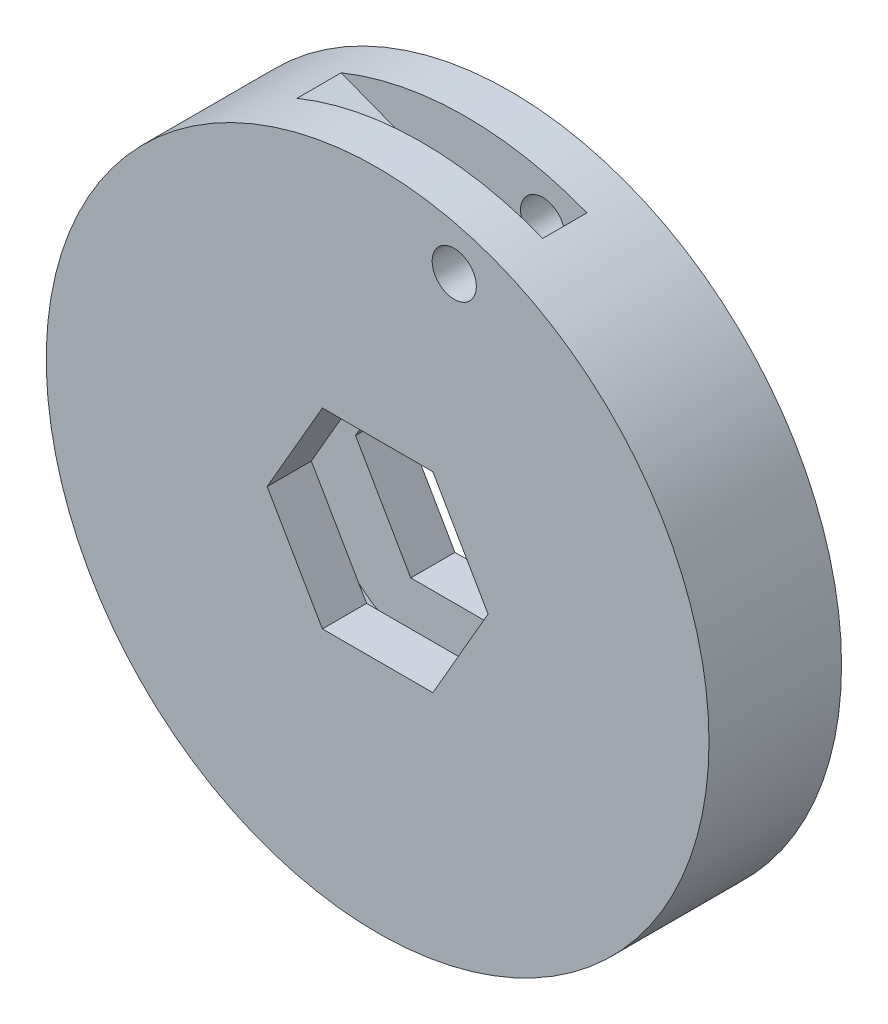
from build123d import *
from build123d.topology import SkipClean

# Parameters (mm, degrees)
SKETCH_1_R               = 15
EXTRUDE_1_DEPTH          = 6
CUT_EXTRUDE_1_DEPTH      = 23.045407685
SKETCH_5_R               = 7.5
CUT_EXTRUDE_2_DEPTH      = 23.045407685
EXTRUDE_START            = -2
SKETCH_6_R               = 15
EXTRUDE_4_DEPTH          = 2
SKETCH_7_R               = 15
EXTRUDE_5_DEPTH          = 2
CUT_EXTRUDE_3_DEPTH      = 22.587033145
CUT_EXTRUDE_3_DEPTH_BACK = 22.587033145
SKETCH_8_R               = 1
CUT_EXTRUDE_4_DEPTH      = 23.045407685


with BuildPart() as part:
    # 草图1 → 凸台-拉伸1 (new body)
    with BuildSketch(Plane.XY):
        Circle(SKETCH_1_R)
    extrude(amount=EXTRUDE_1_DEPTH)

    # 草图2 → 切除-拉伸1 (cut, through all)
    with BuildSketch(Plane.XY.offset(6)):
        with BuildLine():
            Line((-5.64957048, 13.895407637), (2.749675697, 10.662349694))
            ThreePointArc((2.749675697, 10.662349694), (4.597345514, 10.878128051), (5.468121165, 12.521963144))
            Line((5.468121165, 12.521963144), (5.473092316, 13.965860536))
            ThreePointArc((5.473092316, 13.965860536), (-0.095010727, 14.999699096), (-5.64957048, 13.895407637))
        make_face()
    extrude(amount=-CUT_EXTRUDE_1_DEPTH, mode=Mode.SUBTRACT)

    # 草图5 → 切除-拉伸2 (cut, through all)
    with BuildSketch(Plane.XY.offset(6)):
        Circle(SKETCH_5_R)
    extrude(amount=-CUT_EXTRUDE_2_DEPTH, mode=Mode.SUBTRACT)

    # 草图6 → 凸台-拉伸4 (add)
    with BuildSketch(Plane.XY.offset(6).offset(EXTRUDE_START)):
        Circle(SKETCH_6_R)
    extrude(amount=EXTRUDE_4_DEPTH)

    # 草图7 → 凸台-拉伸5 (add)
    with SkipClean():  # the faces are left unmerged after this step: merging them gives an invalid solid
        with BuildSketch(Plane(origin=(0, 0, 0), x_dir=(-1, 0, 0), z_dir=(0, 0, -1))):
            Circle(SKETCH_7_R)
        extrude(amount=-EXTRUDE_5_DEPTH)

    # 草图8 → 切除-拉伸3 (cut, two sides: drawn at the far end of the back side and taken through both)
    with SkipClean():  # the faces are left unmerged after this step: merging them gives an invalid solid
        with BuildSketch(Plane.XY.offset(2).offset(-CUT_EXTRUDE_3_DEPTH_BACK)):
            with Locations((3.468133018, 12.572519868)):
                Circle(SKETCH_8_R)
        extrude(amount=CUT_EXTRUDE_3_DEPTH + CUT_EXTRUDE_3_DEPTH_BACK, mode=Mode.SUBTRACT)

    # 草图9 → 切除-拉伸4 (cut, through all)
    with SkipClean():  # the faces are left unmerged after this step: merging them gives an invalid solid
        with BuildSketch(Plane.XY.offset(6)):
            Polygon((2.5, -4.330127019), (5, 0), (2.5, 4.330127019), (-2.5, 4.330127019), (-5, 0), (-2.5, -4.330127019), align=None)
        extrude(amount=-CUT_EXTRUDE_4_DEPTH, mode=Mode.SUBTRACT)


solid = part.part
